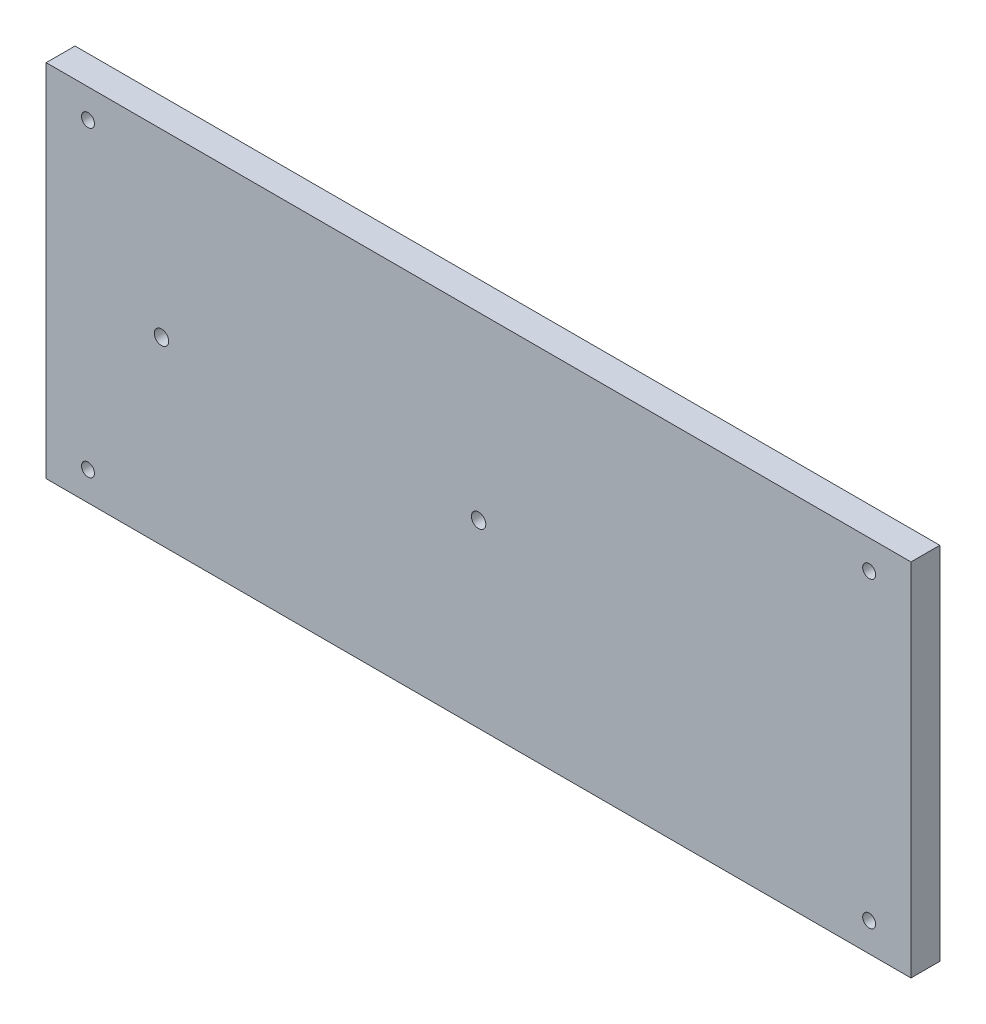
from build123d import *

# Parameters (mm, degrees)
ESQUISSE1_W             = 300
ESQUISSE1_H             = 125
BOSS_EXTRU_1_DEPTH      = 10
ESQUISSE2_R             = 2.25
ENL_V_MAT_EXTRU_1_DEPTH = 10
ESQUISSE3_R             = 2.5
ENL_V_MAT_EXTRU_2_DEPTH = 10


with BuildPart() as part:
    # Esquisse1 → Boss.-Extru.1 (new body)
    with BuildSketch(Plane.XY):
        with Locations((27.555428531, -20.564516129)):
            Rectangle(ESQUISSE1_W, ESQUISSE1_H)
    extrude(amount=BOSS_EXTRU_1_DEPTH)

    # Esquisse2 → Enlèv. mat.-Extru.1 (cut)
    with BuildSketch(Plane(origin=(0, 0, 0), x_dir=(-1, 0, 0), z_dir=(0, 0, -1))):
        with Locations((-163.055428531, -73.064516129)):
            Circle(ESQUISSE2_R)
        with Locations((-163.055428531, 31.935483871)):
            Circle(ESQUISSE2_R)
        with Locations((107.944571469, 31.935483871)):
            Circle(ESQUISSE2_R)
        with Locations((107.944571469, -73.064516129)):
            Circle(ESQUISSE2_R)
    extrude(amount=-ENL_V_MAT_EXTRU_1_DEPTH, mode=Mode.SUBTRACT)

    # Esquisse3 → Enlèv. mat.-Extru.2 (cut)
    with BuildSketch(Plane(origin=(0, 0, 0), x_dir=(-1, 0, 0), z_dir=(0, 0, -1))):
        with Locations((82.444571469, -20.564516129)):
            Circle(ESQUISSE3_R)
        with Locations((-27.555428531, -20.564516129)):
            Circle(ESQUISSE3_R)
    extrude(amount=-ENL_V_MAT_EXTRU_2_DEPTH, mode=Mode.SUBTRACT)


solid = part.part
